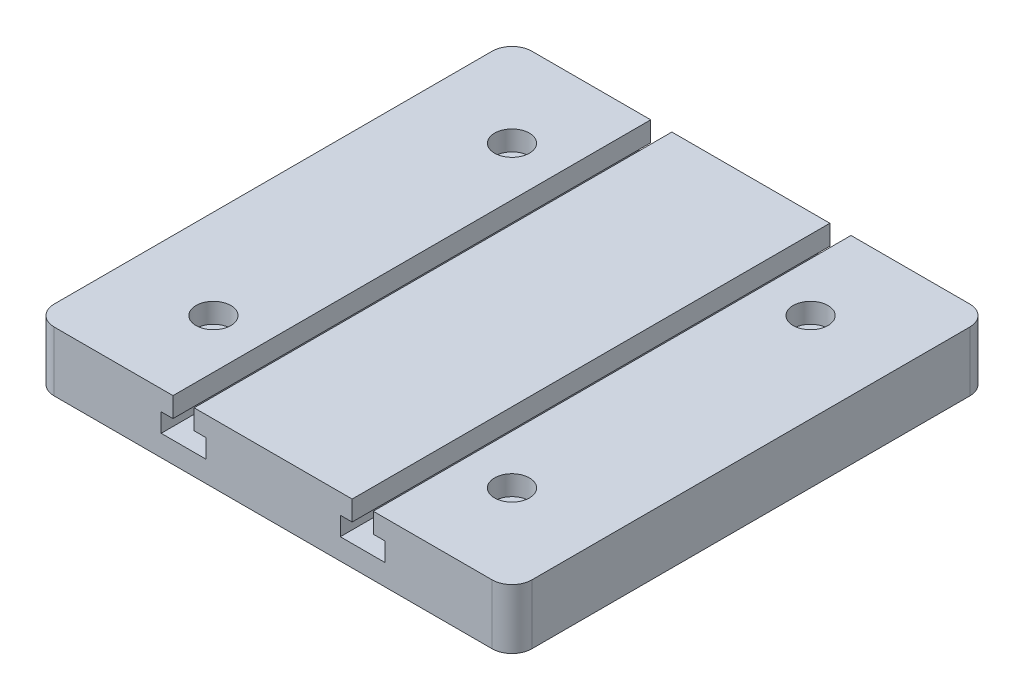
from build123d import *

# Parameters (mm, degrees)
SKETCH1_W                                        = 152.4
SKETCH1_H                                        = 152.4
BOSS_EXTRUDE1_DEPTH                              = 19.05
CBORE_FOR_1_4_SOCKET_HEAD_CAP_SCREW1_D           = 6.5278
CBORE_FOR_1_4_SOCKET_HEAD_CAP_SCREW1_CBORE_D     = 11.1125
CBORE_FOR_1_4_SOCKET_HEAD_CAP_SCREW1_CBORE_DEPTH = 6.35
T_SLOT_CUT_WITH_MCMASTER_8789A16_BIT_DEPTH       = 172.45
FILLET1_R                                        = 6.35


with BuildPart() as part:
    # Sketch1 → Boss-Extrude1 (new body)
    with BuildSketch(Plane(origin=(0, 0, 0), x_dir=(1, 0, 0), z_dir=(0, 1, 0))):
        Rectangle(SKETCH1_W, SKETCH1_H)
    extrude(amount=BOSS_EXTRUDE1_DEPTH)

    # CBORE for 1/4 Socket Head Cap Screw1 (through all)
    with Locations(Plane(origin=(0, 19.05, 0), x_dir=(1, 0, 0), z_dir=(0, 1, 0))):
        with Locations((-47.625, 47.625), (47.625, 47.625), (47.625, -47.625), (-47.625, -47.625)):
            CounterBoreHole(CBORE_FOR_1_4_SOCKET_HEAD_CAP_SCREW1_D / 2, CBORE_FOR_1_4_SOCKET_HEAD_CAP_SCREW1_CBORE_D / 2, CBORE_FOR_1_4_SOCKET_HEAD_CAP_SCREW1_CBORE_DEPTH)

    # Sketch4 → T-SLOT CUT WITH MCMASTER 8789A16 BIT (cut, through all)
    with BuildSketch(Plane.XY.offset(76.2)):
        Polygon((-31.9484375, 19.05), (-31.9484375, 12.7), (-35.71875, 12.7), (-35.71875, 6.746875), (-21.43125, 6.746875), (-21.43125, 12.7), (-25.2015625, 12.7), (-25.2015625, 19.05), align=None)
        Polygon((25.2015625, 12.7), (25.2015625, 19.05), (31.9484375, 19.05), (31.9484375, 12.7), (35.71875, 12.7), (35.71875, 6.746875), (21.43125, 6.746875), (21.43125, 12.7), align=None)
    extrude(amount=-T_SLOT_CUT_WITH_MCMASTER_8789A16_BIT_DEPTH, mode=Mode.SUBTRACT)

    # Fillet1
    fillet1_edges = [part.edges().sort_by_distance(p)[0] for p in [
        (-76.2, 9.525, 76.2),
        (76.2, 9.525, 76.2),
        (76.2, 9.525, -76.2),
        (-76.2, 9.525, -76.2),
    ]]
    fillet(fillet1_edges, radius=FILLET1_R)


solid = part.part
